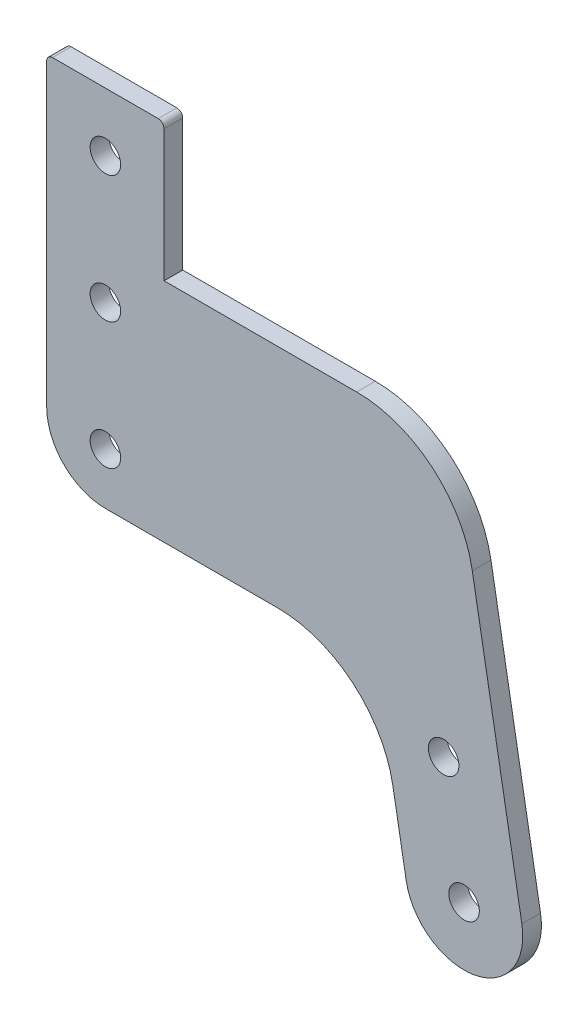
from build123d import *

# Parameters (mm, degrees)
BASE_FLANGE1_DEPTH         = 3.175
F_5_2_5_2_DIAMETER_HOLE1_D = 5.2


# Sheet-metal steps are written as plain solids
with BuildPart() as part:
    # Sketch11 → Base-Flange1 (new body)
    with BuildSketch(Plane.XY.offset(423.175)):
        with BuildLine():
            Line((80.932869831, 272.193100025), (72.492212082, 320.048916024))
            ThreePointArc((72.492212082, 320.048916024), (65.651606735, 331.8961997), (52.796224992, 336.575))
            Line((52.796224992, 336.575), (20, 336.575))
            Line((20, 336.575), (20, 359))
            ThreePointArc((20, 359), (19.707106781, 359.707106781), (19, 360))
            Line((19, 360), (1, 360))
            ThreePointArc((1, 360), (0.292893219, 359.707106781), (0, 359))
            Line((0, 359), (0, 308))
            ThreePointArc((0, 308), (2.928932188, 300.928932188), (10, 298))
            Line((10, 298), (39.289001969, 298))
            ThreePointArc((39.289001969, 298), (52.143642752, 293.321821378), (58.984652965, 281.475821034))
            Line((58.984652965, 281.475821034), (61.236098321, 268.718063502))
            ThreePointArc((61.236098321, 268.718063502), (65.348951759, 262.263898856), (72.820881831, 260.607980474))
            ThreePointArc((72.820881831, 260.607980474), (79.276674092, 264.720773785), (80.932869831, 272.193100025))
        make_face()
    extrude(amount=-BASE_FLANGE1_DEPTH)

    # Ø5.2 (5.2) Diameter Hole1 (through all)
    with Locations(Plane.XY.offset(423.175)):
        with Locations((67.610960265, 290.15212908), (10, 349.9999998), (10, 328.3784093), (10, 306.7568188), (71.083923819, 270.455974019)):
            Hole(F_5_2_5_2_DIAMETER_HOLE1_D / 2)


solid = part.part
